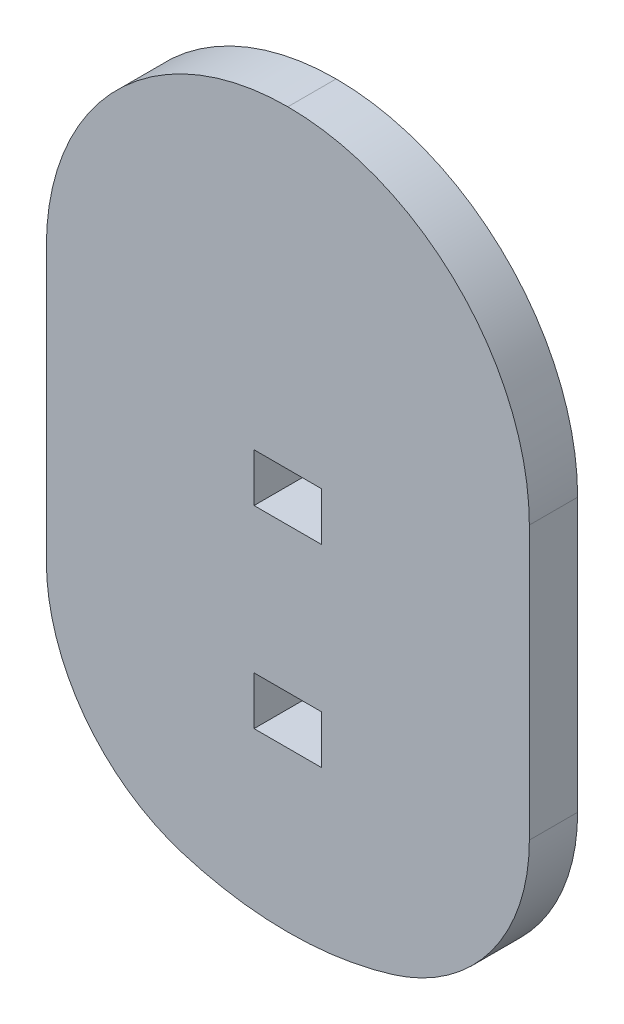
from build123d import *

# Parameters (mm, degrees)
SKETCH1_R           = 37
BOSS_EXTRUDE1_DEPTH = 5
CUT_EXTRUDE3_START  = -10
CUT_EXTRUDE3_DEPTH  = 10
FILLET1_R           = 25
FILLET2_R           = 20
SKETCH11_W          = 7
SKETCH11_H          = 5
CUT_EXTRUDE4_DEPTH  = 10


with BuildPart() as part:
    # Sketch1 → Boss-Extrude1 (new body)
    with BuildSketch(Plane.XY):
        Circle(SKETCH1_R)
    extrude(amount=BOSS_EXTRUDE1_DEPTH)

    # Sketch10 → Cut-Extrude3 (cut)
    with BuildSketch(Plane.XY.offset(5).offset(CUT_EXTRUDE3_START)):
        with BuildLine():
            Line((-25, 27.276363394), (-25, -27.276363394))
            ThreePointArc((-25, -27.276363394), (-37, 0), (-25, 27.276363394))
        make_face()
        with BuildLine():
            Line((25, -27.276363394), (25, 27.276363394))
            ThreePointArc((25, 27.276363394), (37, 0), (25, -27.276363394))
        make_face()
    extrude(amount=CUT_EXTRUDE3_DEPTH, mode=Mode.SUBTRACT)

    # Fillet1
    fillet1_edges = [part.edges().sort_by_distance(p)[0] for p in [
        (-25, 27.276363394, 2.5),
        (25, 27.276363394, 2.5),
    ]]
    fillet(fillet1_edges, radius=FILLET1_R - 0.0001)  # a hair under: the kernel refuses the full size

    # Fillet2
    fillet2_edges = [part.edges().sort_by_distance(p)[0] for p in [
        (-25, -27.276363394, 2.5),
        (25, -27.276363394, 2.5),
    ]]
    fillet(fillet2_edges, radius=FILLET2_R)

    # Sketch11 → Cut-Extrude4 (cut)
    with BuildSketch(Plane.XY.offset(5)):
        with Locations((0, 2)):
            Rectangle(SKETCH11_W, SKETCH11_H)
        with Locations((0, -18)):
            Rectangle(SKETCH11_W, SKETCH11_H)
    extrude(amount=-CUT_EXTRUDE4_DEPTH, mode=Mode.SUBTRACT)


solid = part.part
